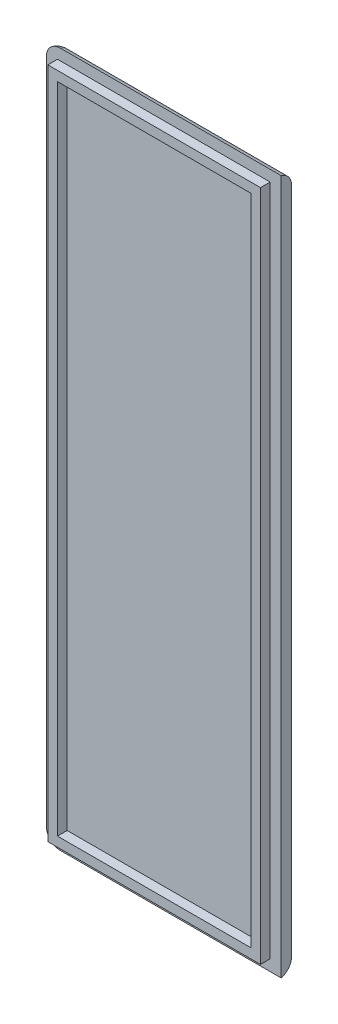
from build123d import *

# Parameters (mm, degrees)
ESQUISSE1_W        = 34
ESQUISSE1_H        = 100.65
BOSS_EXTRU_1_DEPTH = 1.5
ESQUISSE2_W        = 30.8
ESQUISSE2_H        = 97.45
ESQUISSE2_W_2      = 28
ESQUISSE2_H_2      = 94.65
BOSS_EXTRU_2_DEPTH = 1.4
CONG_6_R           = 2
CONG_8_R           = 2
CONG_9_R           = 2


with BuildPart() as part:
    # Esquisse1 → Boss.-Extru.1 (new body)
    with BuildSketch(Plane.XY):
        with Locations((17, 50.325)):
            Rectangle(ESQUISSE1_W, ESQUISSE1_H)
    extrude(amount=BOSS_EXTRU_1_DEPTH)

    # Esquisse2 → Boss.-Extru.2 (add)
    with BuildSketch(Plane.XY.offset(1.5)):
        with Locations((17, 50.325)):
            Rectangle(ESQUISSE2_W, ESQUISSE2_H)
        with Locations((17, 50.325)):
            Rectangle(ESQUISSE2_W_2, ESQUISSE2_H_2, mode=Mode.SUBTRACT)
    extrude(amount=BOSS_EXTRU_2_DEPTH)

    # Congé6
    cong_6_edges = [part.edges().sort_by_distance(p)[0] for p in [
        (0, 0, 0.75),
    ]]
    fillet(cong_6_edges, radius=CONG_6_R)

    # Congé8
    cong_8_edges = [part.edges().sort_by_distance(p)[0] for p in [
        (0, 100.65, 0.75),
    ]]
    fillet(cong_8_edges, radius=CONG_8_R)

    # Congé9
    # the kernel refuses this fillet: 2 mm, written as the material it takes off along each edge
    with BuildSketch(Plane(origin=(38.841229183, 100.65, 0), x_dir=(0, -1, 0), z_dir=(-1, 0, 0)), Plane(origin=(2, 0, 0), x_dir=(0, 1, 0), z_dir=(1, 0, 0))) as cong_9_piece_1:
        with BuildLine():
            CenterArc((1.936491673, 2), CONG_9_R, 194.477512186, 75.522487814)
            Line((0, 1.5), (-0.038729833, 1.49))
            ThreePointArc((-0.038729833, 1.49), (-0.04, 0.75), (-0.04, 0))
            Line((-0.04, 0), (0, -0.04))
            Line((0, -0.04), (1.936491673, -0.04))
            Line((1.936491673, -0.04), (1.936491673, 0))
        make_face()
    extrude(amount=36.841229183, mode=Mode.SUBTRACT)
    with BuildSketch(Plane(origin=(2, 98.65, 0), x_dir=(-1, 0, 0), z_dir=(0, -1, 0))) as cong_9_piece_2:
        with BuildLine():
            CenterArc((0.063508327, -2), CONG_9_R, 14.477512186, 75.522487814)
            Line((2, -1.5), (2.038729833, -1.49))
            ThreePointArc((2.038729833, -1.49), (2.04, -0.75), (2.04, 0))
            Line((2.04, 0), (2, 0.04))
            Line((2, 0.04), (0.063508327, 0.04))
            Line((0.063508327, 0.04), (0.063508327, 0))
        make_face()
    revolve(axis=Axis((2, 98.65, 0), (0, 0, -1)), revolution_arc=90, mode=Mode.SUBTRACT)
    with BuildSketch(Plane(origin=(0, 98.65, 0), x_dir=(1, 0, 0), z_dir=(0, -1, 0))) as cong_9_piece_3:
        with BuildLine():
            CenterArc((1.936491673, 2), CONG_9_R, 194.477512186, 75.522487814)
            Line((0, 1.5), (-0.038729833, 1.49))
            ThreePointArc((-0.038729833, 1.49), (-0.04, 0.75), (-0.04, 0))
            Line((-0.04, 0), (0, -0.04))
            Line((0, -0.04), (1.936491673, -0.04))
            Line((1.936491673, -0.04), (1.936491673, 0))
        make_face()
    extrude(amount=96.65, mode=Mode.SUBTRACT)
    with BuildSketch(Plane(origin=(2, 2, 0), x_dir=(0, -1, 0), z_dir=(1, 0, 0))) as cong_9_piece_4:
        with BuildLine():
            CenterArc((0.063508327, -2), CONG_9_R, 14.477512186, 75.522487814)
            Line((2, -1.5), (2.038729833, -1.49))
            ThreePointArc((2.038729833, -1.49), (2.04, -0.75), (2.04, 0))
            Line((2.04, 0), (2, 0.04))
            Line((2, 0.04), (0.063508327, 0.04))
            Line((0.063508327, 0.04), (0.063508327, 0))
        make_face()
    revolve(axis=Axis((2, 2, 0), (0, 0, -1)), revolution_arc=90, mode=Mode.SUBTRACT)


solid = part.part
